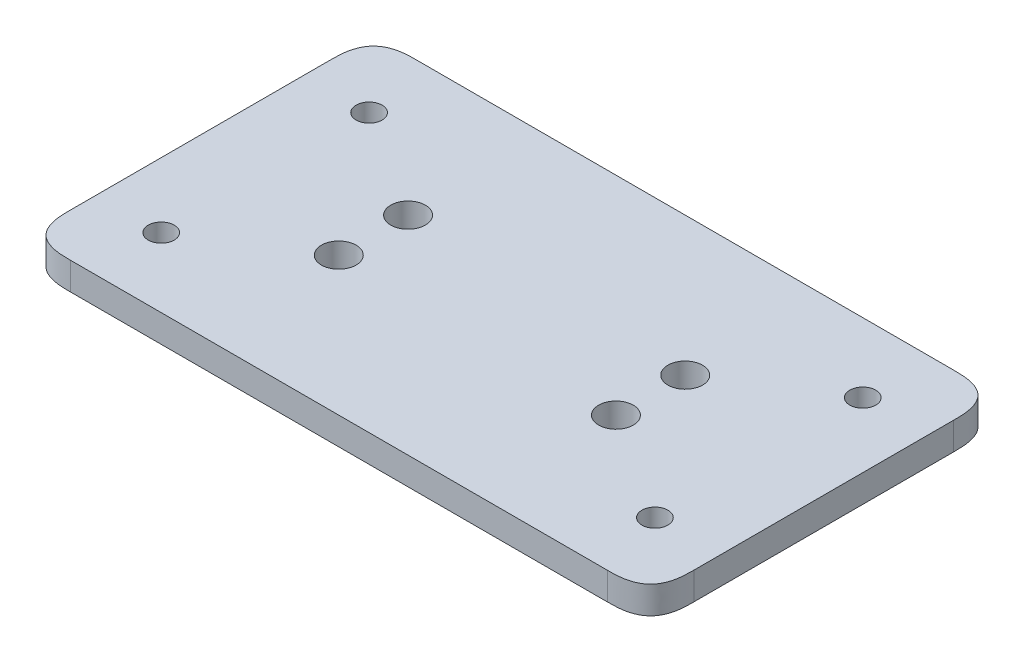
from build123d import *

# Parameters (mm, degrees)
SKETCH1_W           = 72
SKETCH1_H           = 40
SKETCH1_R           = 2
SKETCH1_R_2         = 1.5
BOSS_EXTRUDE1_DEPTH = 3.175
FILLET1_SIZE        = 5


with BuildPart() as part:
    # Sketch1 → Boss-Extrude1 (new body)
    with BuildSketch(Plane(origin=(0, 0, 0), x_dir=(1, 0, 0), z_dir=(0, 1, 0))):
        with Locations((36, 20)):
            Rectangle(SKETCH1_W, SKETCH1_H)
        with Locations(Location((20, 24, 0), (0, 0, 270))):
            Circle(SKETCH1_R, mode=Mode.SUBTRACT)
        with Locations(Location((20, 16, 0), (0, 0, 270))):
            Circle(SKETCH1_R, mode=Mode.SUBTRACT)
        with Locations(Location((52, 24, 0), (0, 0, 270))):
            Circle(SKETCH1_R, mode=Mode.SUBTRACT)
        with Locations(Location((52, 16, 0), (0, 0, 270))):
            Circle(SKETCH1_R, mode=Mode.SUBTRACT)
        with Locations(Location((7.5, 32, 0), (0, 0, 270))):
            Circle(SKETCH1_R_2, mode=Mode.SUBTRACT)
        with Locations(Location((7.5, 8, 0), (0, 0, 270))):
            Circle(SKETCH1_R_2, mode=Mode.SUBTRACT)
        with Locations(Location((64.5, 8, 0), (0, 0, 270))):
            Circle(SKETCH1_R_2, mode=Mode.SUBTRACT)
        with Locations(Location((64.5, 32, 0), (0, 0, 270))):
            Circle(SKETCH1_R_2, mode=Mode.SUBTRACT)
    extrude(amount=BOSS_EXTRUDE1_DEPTH)

    # Fillet1
    # a fillet whose section is not a circle: 5 mm, written as the material it takes off along each edge
    with BuildSketch(Plane(origin=(0, -12.5, -40), x_dir=(1, 0, 0), z_dir=(0, 1, 0)), Plane(origin=(72, -12.5, 0), x_dir=(-1, 0, 0), z_dir=(0, 1, 0)), Plane(origin=(72, -12.5, -40), x_dir=(0, 0, 1), z_dir=(0, 1, 0))) as fillet1_piece_1:
        with BuildLine():
            add(Edge.make_bspline([(FILLET1_SIZE, 0), (FILLET1_SIZE * 0.831801948466, 0), (FILLET1_SIZE * 0.663603896932, 0), (FILLET1_SIZE * 0.292893218813, -FILLET1_SIZE * 0.0716919198361), (FILLET1_SIZE * 0.0716919198361, -FILLET1_SIZE * 0.292893218813), (0, -FILLET1_SIZE * 0.663603896932), (0, -FILLET1_SIZE * 0.831801948466), (0, -FILLET1_SIZE)], knots=[0, 0, 0, 0, 0, 0, 0.5, 0.5, 1, 1, 1, 1, 1, 1], degree=5))
            Line((0, -FILLET1_SIZE), (0, 0))
            Line((0, 0), (FILLET1_SIZE, 0))
        make_face()
    extrude(amount=28.175, mode=Mode.SUBTRACT)
    with BuildSketch(Plane(origin=(0, -12.5, 0), x_dir=(1, 0, 0), z_dir=(0, 1, 0))) as fillet1_piece_2:
        with BuildLine():
            add(Edge.make_bspline([(FILLET1_SIZE, 0), (FILLET1_SIZE * 0.831801948466, 0), (FILLET1_SIZE * 0.663603896932, 0), (FILLET1_SIZE * 0.292893218813, FILLET1_SIZE * 0.0716919198361), (FILLET1_SIZE * 0.0716919198361, FILLET1_SIZE * 0.292893218813), (0, FILLET1_SIZE * 0.663603896932), (0, FILLET1_SIZE * 0.831801948466), (0, FILLET1_SIZE)], knots=[0, 0, 0, 0, 0, 0, 0.5, 0.5, 1, 1, 1, 1, 1, 1], degree=5))
            Line((0, FILLET1_SIZE), (0, 0))
            Line((0, 0), (FILLET1_SIZE, 0))
        make_face()
    extrude(amount=28.175, mode=Mode.SUBTRACT)


solid = part.part
